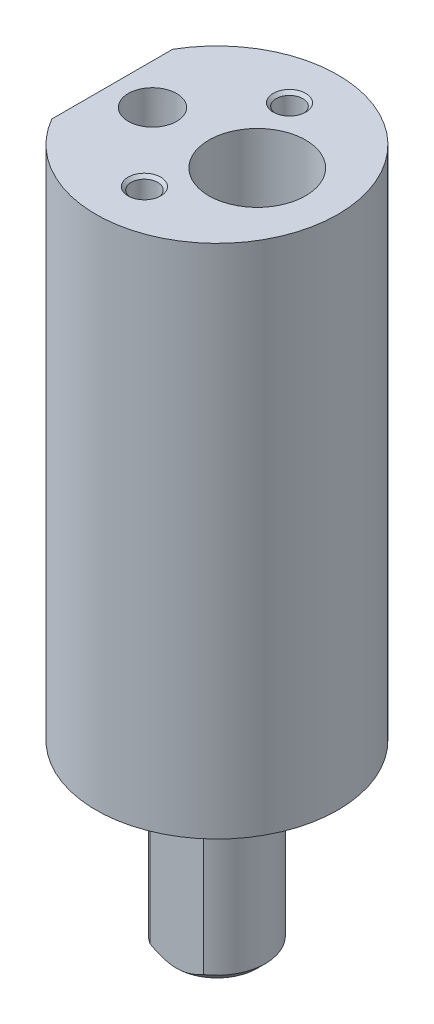
from build123d import *

# Parameters (mm, degrees)
BOSS_EXTRUDE1_DEPTH         = 22
BOSS_EXTRUDE2_DEPTH         = 64
SKETCH3_R                   = 3
CUT_EXTRUDE1_DEPTH          = 65
SKETCH4_R                   = 6
CUT_EXTRUDE2_DEPTH          = 52
M4_TAPPED_HOLE1_D           = 3.3
M4_TAPPED_HOLE1_DEPTH       = 14
M4_TAPPED_HOLE1_CSINK_D     = 4.05
M4_TAPPED_HOLE1_CSINK_ANGLE = 90
M4_TAPPED_HOLE1_TIP         = 0.991420021
SKETCH7_R                   = 2.5
SKETCH7_R_2                 = 1.5
CUT_EXTRUDE3_DEPTH          = 5
SKETCH8_R                   = 1
CUT_EXTRUDE4_DEPTH          = 15
CHAMFER1_SIZE               = 1


with BuildPart() as part:
    # Sketch1 → Boss-Extrude1 (new body)
    with BuildSketch(Plane(origin=(0, 0, 0), x_dir=(1, 0, 0), z_dir=(0, 1, 0))):
        with BuildLine():
            Line((-3.31662479, -5), (3.31662479, -5))
            ThreePointArc((3.31662479, -5), (0, 6), (-3.31662479, -5))
        make_face()
    extrude(amount=BOSS_EXTRUDE1_DEPTH)

    # Sketch2 → Boss-Extrude2 (add)
    with BuildSketch(Plane(origin=(0, 22, 0), x_dir=(1, 0, 0), z_dir=(0, 1, 0))):
        with BuildLine():
            Line((-13, 7.483314774), (-13, -7.483314774))
            ThreePointArc((-13, -7.483314774), (15, 0), (-13, 7.483314774))
        make_face()
    extrude(amount=BOSS_EXTRUDE2_DEPTH)

    # Sketch3 → Cut-Extrude1 (cut)
    with BuildSketch(Plane(origin=(0, 86, 0), x_dir=(1, 0, 0), z_dir=(0, 1, 0))):
        with Locations(Location((-8, 0, 0), (0, 0, 270))):
            Circle(SKETCH3_R)
    extrude(amount=-CUT_EXTRUDE1_DEPTH, mode=Mode.SUBTRACT)

    # Sketch4 → Cut-Extrude2 (cut)
    with BuildSketch(Plane(origin=(0, 86, 0), x_dir=(1, 0, 0), z_dir=(0, 1, 0))):
        with Locations(Location((5, 0, 0), (0, 0, 270))):
            Circle(SKETCH4_R)
    extrude(amount=-CUT_EXTRUDE2_DEPTH, mode=Mode.SUBTRACT)

    # M4 Tapped Hole1
    with Locations(Plane(origin=(0, 86, 0), x_dir=(1, 0, 0), z_dir=(0, 1, 0))):
        with Locations((0, 9), (0, -9)):
            CounterSinkHole(M4_TAPPED_HOLE1_D / 2, M4_TAPPED_HOLE1_CSINK_D / 2, depth=M4_TAPPED_HOLE1_DEPTH, counter_sink_angle=M4_TAPPED_HOLE1_CSINK_ANGLE)
            with Locations((0, 0, -(M4_TAPPED_HOLE1_DEPTH + M4_TAPPED_HOLE1_TIP / 2))):  # 118° drill point
                Cone(0, M4_TAPPED_HOLE1_D / 2, M4_TAPPED_HOLE1_TIP, mode=Mode.SUBTRACT)

    # Sketch7 → Cut-Extrude3 (cut)
    with BuildSketch(Plane.ZY.offset(13)):
        with Locations((0, 54)):
            Circle(SKETCH7_R)
        with Locations((0, 25)):
            Circle(SKETCH7_R_2)
    extrude(amount=-CUT_EXTRUDE3_DEPTH, mode=Mode.SUBTRACT)

    # Sketch8 → Cut-Extrude4 (cut)
    with BuildSketch(Plane.ZY.offset(13)):
        with Locations((0, 76)):
            Circle(SKETCH8_R)
        with Locations((0, 34)):
            Circle(SKETCH8_R)
    extrude(amount=-CUT_EXTRUDE4_DEPTH, mode=Mode.SUBTRACT)

    # Chamfer1
    chamfer1_edges = [part.edges().sort_by_distance(p)[0] for p in [
        (0, 0, -6),
    ]]
    chamfer(chamfer1_edges, length=CHAMFER1_SIZE - 0.0001)  # a hair under: the kernel refuses the full size


solid = part.part
